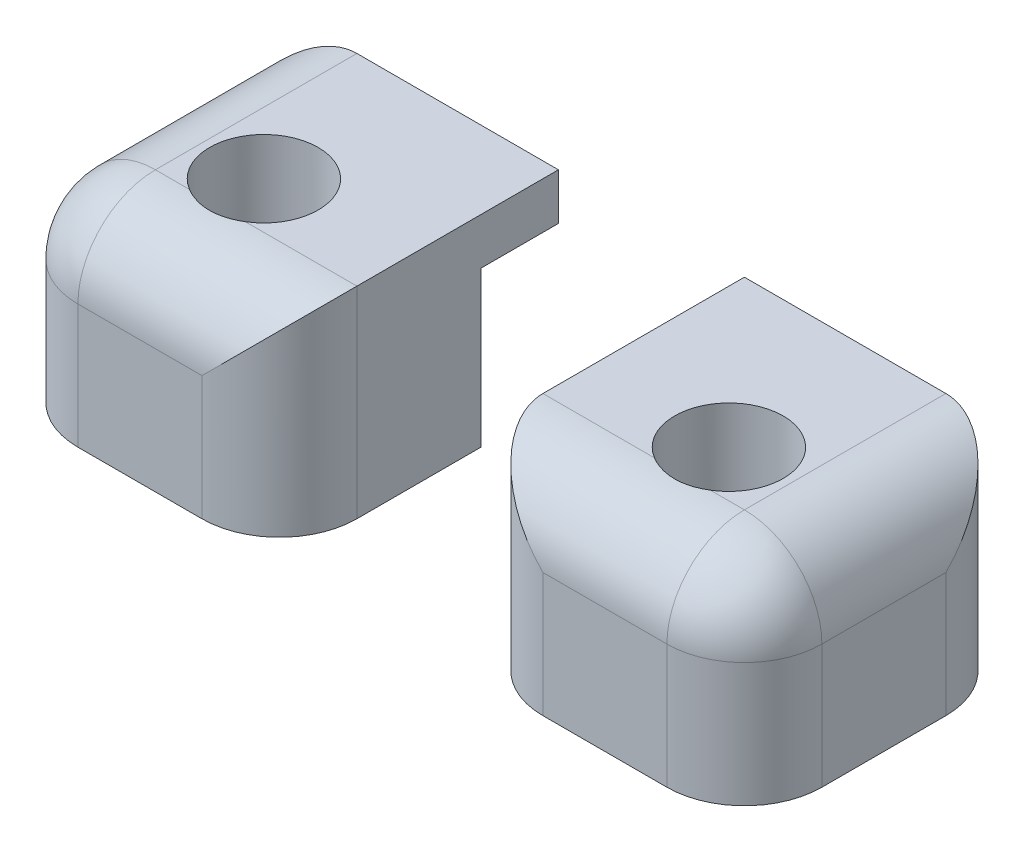
from build123d import *

# Parameters (mm, degrees)
BOSS_EXTRUDE1_DEPTH = 10
BOSS_EXTRUDE2_START = 10
SKETCH1_3_W         = 10
SKETCH1_3_H         = 5
BOSS_EXTRUDE2_DEPTH = 3
SKETCH2_R           = 3.5
SKETCH2_R_2         = 2
CUT_EXTRUDE1_DEPTH  = 10
SKETCH2_2_R         = 2
CUT_EXTRUDE2_DEPTH  = 19.193405399
CHAMFER1_SIZE       = 1
FILLET1_R           = 5


with BuildPart() as part:
    # Sketch1 → Boss-Extrude1 (new body)
    with BuildSketch(Plane(origin=(0, 0, 0), x_dir=(1, 0, 0), z_dir=(0, 1, 0))):
        Polygon((-9, 9), (-9, -9), (9, -9), (9, 4), (-1, 4), (-1, 9), align=None)
    extrude(amount=BOSS_EXTRUDE1_DEPTH)

    # Sketch1<3> → Boss-Extrude2 (add)
    with BuildSketch(Plane(origin=(0, 0, 0), x_dir=(1, 0, 0), z_dir=(0, 1, 0)).offset(BOSS_EXTRUDE2_START)):
        with Locations((4, 6.5)):
            Rectangle(SKETCH1_3_W, SKETCH1_3_H)
        Polygon((-9, 9), (-9, -9), (9, -9), (9, 4), (-1, 4), (-1, 9), align=None)
    extrude(amount=BOSS_EXTRUDE2_DEPTH)

    # Sketch2 → Cut-Extrude1 (cut)
    with BuildSketch(Plane(origin=(0, 13, 0), x_dir=(1, 0, 0), z_dir=(0, 1, 0))):
        with Locations(Location((0, -1, 0), (0, 0, 270))):
            Circle(SKETCH2_R)
        with Locations(Location((0, -1, 0), (0, 0, 270))):
            Circle(SKETCH2_R_2, mode=Mode.SUBTRACT)
    extrude(amount=-CUT_EXTRUDE1_DEPTH, mode=Mode.SUBTRACT)

    # Sketch2<2> → Cut-Extrude2 (cut, through all)
    with BuildSketch(Plane(origin=(0, 13, 0), x_dir=(1, 0, 0), z_dir=(0, 1, 0))):
        with Locations(Location((0, -1, 0), (0, 0, 270))):
            Circle(SKETCH2_2_R)
    extrude(amount=-CUT_EXTRUDE2_DEPTH, mode=Mode.SUBTRACT)

    # Chamfer1
    chamfer1_edges = [part.edges().sort_by_distance(p)[0] for p in [
        (0, 3, -1),
    ]]
    chamfer(chamfer1_edges, length=CHAMFER1_SIZE)

    # Fillet1
    # the kernel refuses this fillet: 5 mm, written as the material it takes off along each edge
    with BuildSketch(Plane(origin=(-4, 8, 4), x_dir=(0, 1, 0), z_dir=(0, 0, 1))) as fillet1_piece_1_section:
        Polygon((0, 0), (FILLET1_R, 0), (FILLET1_R, FILLET1_R), (0, FILLET1_R), align=None)
    fillet1_piece_1 = extrude(amount=FILLET1_R, mode=Mode.PRIVATE)
    fillet1_piece_1 = fillet1_piece_1 - Plane(origin=(-4, 8, 4), x_dir=(0.7071067811865475, -0.7071067811865475, 0), z_dir=(0, 0, 1)) * Sphere(FILLET1_R, mode=Mode.PRIVATE)
    add(fillet1_piece_1, mode=Mode.SUBTRACT)
    with BuildSketch(Plane(origin=(9, -12.5, 9), x_dir=(-1, 0, 0), z_dir=(0, 1, 0)), Plane(origin=(-9, -12.5, -9), x_dir=(1, 0, 0), z_dir=(0, 1, 0))) as fillet1_piece_2:
        with BuildLine():
            CenterArc((FILLET1_R, -FILLET1_R), FILLET1_R, 90, 90)
            Line((0, -FILLET1_R), (0, 0))
            Line((0, 0), (FILLET1_R, 0))
        make_face()
    extrude(amount=38, mode=Mode.SUBTRACT)
    with BuildSketch(Plane(origin=(-9, -12.5, 9), x_dir=(0, 0, -1), z_dir=(0, 1, 0))) as fillet1_piece_3:
        with BuildLine():
            CenterArc((FILLET1_R, -FILLET1_R), FILLET1_R, 90, 90)
            Line((0, -FILLET1_R), (0, 0))
            Line((0, 0), (FILLET1_R, 0))
        make_face()
    extrude(amount=20.5, mode=Mode.SUBTRACT)
    with BuildSketch(Plane(origin=(-9, 13, -21.5), x_dir=(0, -1, 0), z_dir=(0, 0, 1)), Plane(origin=(-4, 13, 9), x_dir=(0, -1, 0), z_dir=(1, 0, 0))) as fillet1_piece_4:
        with BuildLine():
            CenterArc((FILLET1_R, FILLET1_R), FILLET1_R, 180, 90)
            Line((0, FILLET1_R), (0, 0))
            Line((0, 0), (FILLET1_R, 0))
        make_face()
    extrude(amount=25.5, mode=Mode.SUBTRACT)


with BuildPart() as body_2:
    # Mirror2: mirrored copy
    add(part.part.mirror(Plane(origin=(15, 0, 0), x_dir=(0, 0, 1), z_dir=(1, 0, 0))))


solid = Compound([part.part, body_2.part])
